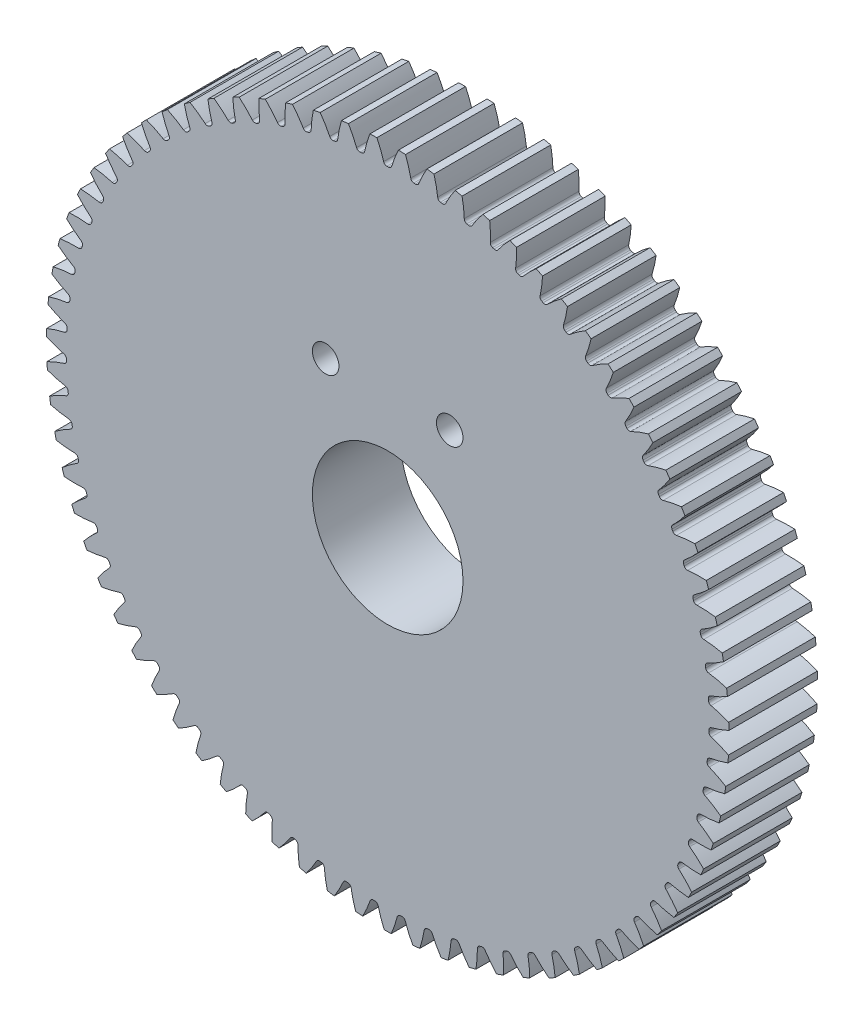
from build123d import *

# Parameters (mm, degrees)
SKETCH_1_R               = 38.5
LASHENA_DEPTH            = 10
CUT_EXTRUDEA_DEPTH       = 30
PATTERN_CIRCULAR_1_COUNT = 75
SKETCH_3_R               = 8.5
SKETCH_3_R_2             = 1.5
CUT_EXTRUDE_2_DEPTH      = 10


with BuildPart() as part:
    # 草图1 → LaShenA (new body)
    with BuildSketch(Plane.XY):
        Circle(SKETCH_1_R)
    extrude(amount=LASHENA_DEPTH)

    # SketchA → Cut-ExtrudeA (cut)
    with BuildSketch(Plane.XY.offset(10)):
        with BuildLine():
            ThreePointArc((0.091577355, 36.249884325), (0, 36.25), (-0.091577355, 36.249884325))
            ThreePointArc((-0.091577355, 36.249884325), (-0.320511841, 36.325863991), (-0.457587272, 36.524343801))
            add(Edge.make_bspline(
                [(-0.457587272, 36.524343801), (-0.460821953, 36.535532241), (-0.470382685, 36.568511471), (-0.486602543, 36.623768686), (-0.50675522, 36.690545595), (-0.527851198, 36.758788572), (-0.549927552, 36.828482717), (-0.573000874, 36.899619056), (-0.597093316, 36.972186691), (-0.622225365, 37.046174975), (-0.64841784, 37.121572911), (-0.67569134, 37.198369321), (-0.704066389, 37.276552799), (-0.733563399, 37.356111725), (-0.764202674, 37.437034264), (-0.796004408, 37.519308366), (-0.828988683, 37.602921767), (-0.863175466, 37.687861991), (-0.898584606, 37.77411635), (-0.935235836, 37.861671946), (-0.973148769, 37.950515671), (-1.012342893, 38.040634209), (-1.052837575, 38.132014036), (-1.094652053, 38.224641422), (-1.137805439, 38.318502432), (-1.182316714, 38.413582926), (-1.228204727, 38.509868562), (-1.275488195, 38.607344795), (-1.324185695, 38.705996882), (-1.391527659, 38.840080374), (-1.443465088, 38.940858442), (-1.478804602, 39.008300624)],
                knots=[0.096665642, 0.096665642, 0.096665642, 0.096665642, 0.108397743, 0.131255784, 0.154677173, 0.178661909, 0.203209993, 0.228321424, 0.253996203, 0.280234329, 0.307035802, 0.334400623, 0.362328792, 0.390820307, 0.41987517, 0.449493381, 0.479674939, 0.510419844, 0.541728097, 0.573599698, 0.606034645, 0.63903294, 0.672594583, 0.706719573, 0.74140791, 0.776659595, 0.812474627, 0.848853007, 0.885794734, 0.923299809, 1, 1, 1, 1], degree=3))
            ThreePointArc((-1.478804602, 39.008300624), (0, 39.0363213), (1.478804602, 39.008300624))
            add(Edge.make_bspline(
                [(0.457587272, 36.524343801), (0.460821953, 36.535532241), (0.470382685, 36.568511471), (0.486602543, 36.623768686), (0.50675522, 36.690545595), (0.527851198, 36.758788572), (0.549927552, 36.828482717), (0.573000874, 36.899619056), (0.597093316, 36.972186691), (0.622225365, 37.046174975), (0.64841784, 37.121572911), (0.67569134, 37.198369321), (0.704066389, 37.276552799), (0.733563399, 37.356111725), (0.764202674, 37.437034264), (0.796004408, 37.519308366), (0.828988683, 37.602921767), (0.863175466, 37.687861991), (0.898584606, 37.77411635), (0.935235836, 37.861671946), (0.973148769, 37.950515671), (1.012342893, 38.040634209), (1.052837575, 38.132014036), (1.094652053, 38.224641422), (1.137805439, 38.318502432), (1.182316714, 38.413582926), (1.228204727, 38.509868562), (1.275488195, 38.607344795), (1.324185695, 38.705996882), (1.391527659, 38.840080374), (1.443465088, 38.940858442), (1.478804602, 39.008300624)],
                knots=[0.096665642, 0.096665642, 0.096665642, 0.096665642, 0.108397743, 0.131255784, 0.154677173, 0.178661909, 0.203209993, 0.228321424, 0.253996203, 0.280234329, 0.307035802, 0.334400623, 0.362328792, 0.390820307, 0.41987517, 0.449493381, 0.479674939, 0.510419844, 0.541728097, 0.573599698, 0.606034645, 0.63903294, 0.672594583, 0.706719573, 0.74140791, 0.776659595, 0.812474627, 0.848853007, 0.885794734, 0.923299809, 1, 1, 1, 1], degree=3))
            ThreePointArc((0.457587272, 36.524343801), (0.320511841, 36.325863991), (0.091577355, 36.249884325))
        make_face()
    cut_extrudea = extrude(amount=-CUT_EXTRUDEA_DEPTH, mode=Mode.SUBTRACT)

    # 阵列(圆周)1: Cut-ExtrudeA ×75 about axis
    pattern_circular_1_axis = Axis((0, 0, -80.9), (0, 0, 1))
    for i in range(1, PATTERN_CIRCULAR_1_COUNT):
        add(cut_extrudea.rotate(pattern_circular_1_axis, i * 360 / PATTERN_CIRCULAR_1_COUNT), mode=Mode.SUBTRACT)

    # 草图3 → 切除-拉伸2 (cut)
    with BuildSketch(Plane.XY.offset(10)):
        Circle(SKETCH_3_R)
        with Locations((-7, 14)):
            Circle(SKETCH_3_R_2)
        with Locations((7, 14)):
            Circle(SKETCH_3_R_2)
    extrude(amount=-CUT_EXTRUDE_2_DEPTH, mode=Mode.SUBTRACT)


solid = part.part
